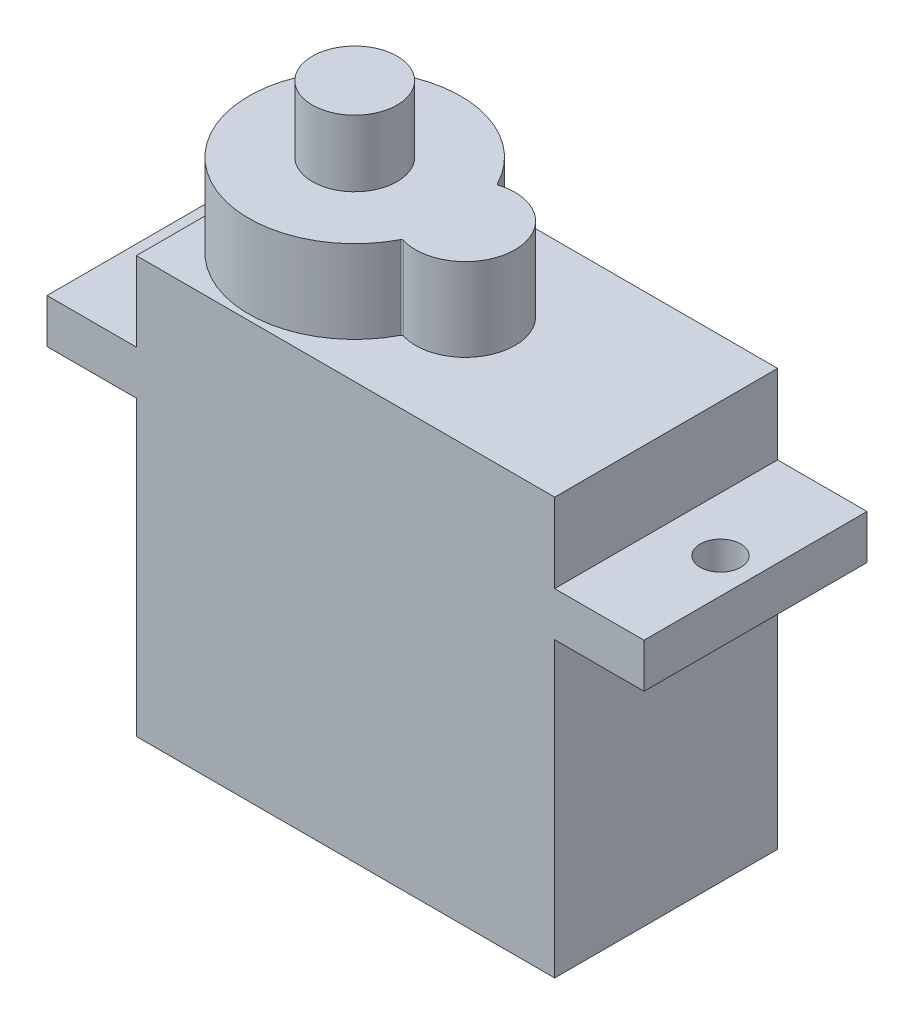
from build123d import *

# Parameters (mm, degrees)
BOSS_EXTRUDE1_DEPTH = 12.1
SKETCH3_R           = 1.1
CUT_EXTRUDE1_DEPTH  = 12.1
BOSS_EXTRUDE2_DEPTH = 4.5
FILLET1_R           = 0.1
SKETCH5_R           = 2.3
BOSS_EXTRUDE3_DEPTH = 3.6


with BuildPart() as part:
    # Sketch1 → Boss-Extrude1 (new body)
    with BuildSketch(Plane.XY):
        Polygon((0, -4.3), (-4.85, -4.3), (-4.85, -6.7), (0, -6.7), (0, -22.6), (22.7, -22.6), (22.7, -6.7), (27.55, -6.7), (27.55, -4.3), (22.7, -4.3), (22.7, 0), (0, 0), align=None)
    extrude(amount=BOSS_EXTRUDE1_DEPTH)

    # Sketch3 → Cut-Extrude1 (cut)
    with BuildSketch(Plane(origin=(0, -4.3, 0), x_dir=(1, 0, 0), z_dir=(0, 1, 0))):
        with Locations((-2.95, -6.05)):
            Circle(SKETCH3_R)
        with Locations((25.65, -6.05)):
            Circle(SKETCH3_R)
    extrude(amount=-CUT_EXTRUDE1_DEPTH, mode=Mode.SUBTRACT)

    # Sketch4 → Boss-Extrude2 (add)
    with BuildSketch(Plane(origin=(0, 0, 0), x_dir=(1, 0, 0), z_dir=(0, 1, 0))):
        with BuildLine():
            ThreePointArc((10.947708333, -3.488047831), (0.05, -6.05), (10.947708333, -8.611952169))
            ThreePointArc((10.947708333, -8.611952169), (14.5, -6.05), (10.947708333, -3.488047831))
        make_face()
    extrude(amount=BOSS_EXTRUDE2_DEPTH)

    # Fillet1
    fillet1_edges = [part.edges().sort_by_distance(p)[0] for p in [
        (10.947708333, 2.25, 3.488047831),
        (10.947708333, 2.25, 8.611952169),
    ]]
    fillet(fillet1_edges, radius=FILLET1_R)

    # Sketch5 → Boss-Extrude3 (add)
    with BuildSketch(Plane(origin=(0, 4.5, 0), x_dir=(1, 0, 0), z_dir=(0, 1, 0))):
        with Locations((5.8, -6.05)):
            Circle(SKETCH5_R)
    extrude(amount=BOSS_EXTRUDE3_DEPTH)


solid = part.part
